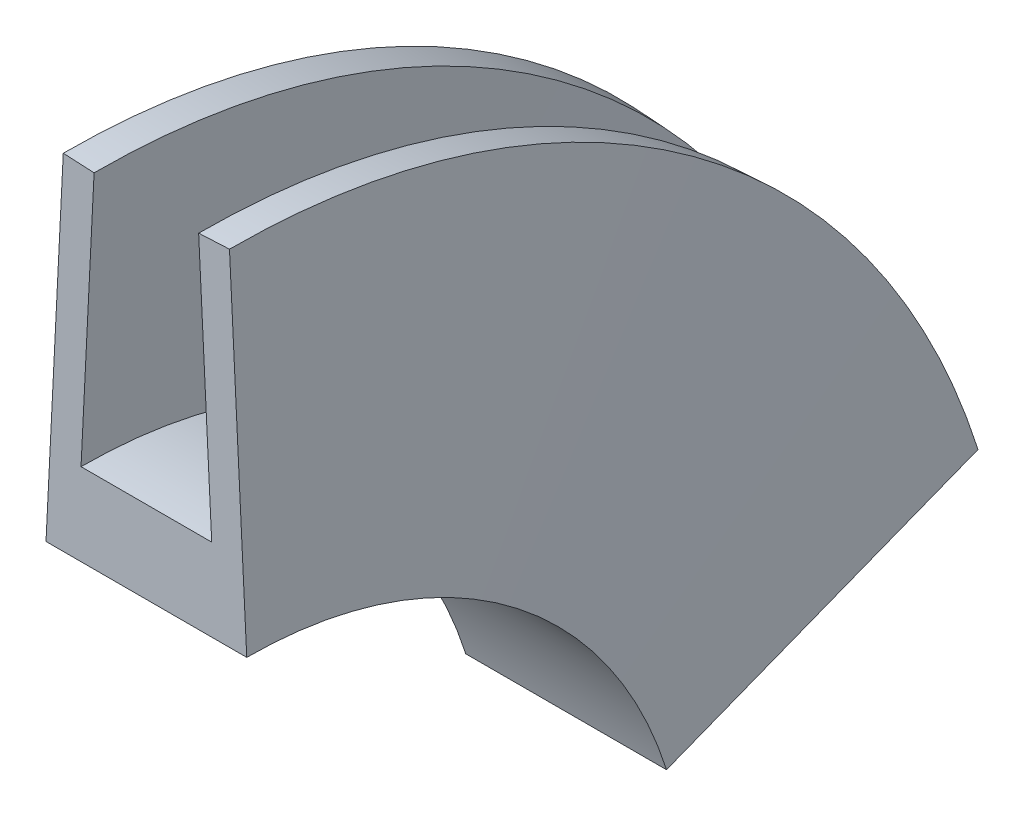
from build123d import *


with BuildPart() as part:
    # Sweep1: sweep along a path in Sketch3
    with BuildLine(Plane(origin=(0, 0, 0), x_dir=(0, 0, -1), z_dir=(1, 0, 0))) as sweep1_path:
        ThreePointArc((0, 0), (7.5, -2.45109762), (12.105002811, -8.858267717))
    # Sketch1 → Sweep1 (sweep)
    with BuildSketch(Plane.XY):
        Polygon((-2.019061913, 6.379557533), (-2.438564496, -2), (2.438564496, -2), (2.019061913, 6.379557533), (1.27, 6.342057533), (1.5875, 0), (-1.5875, 0), (-1.27, 6.342057533), align=None)
    sweep(path=sweep1_path.line)


solid = part.part
